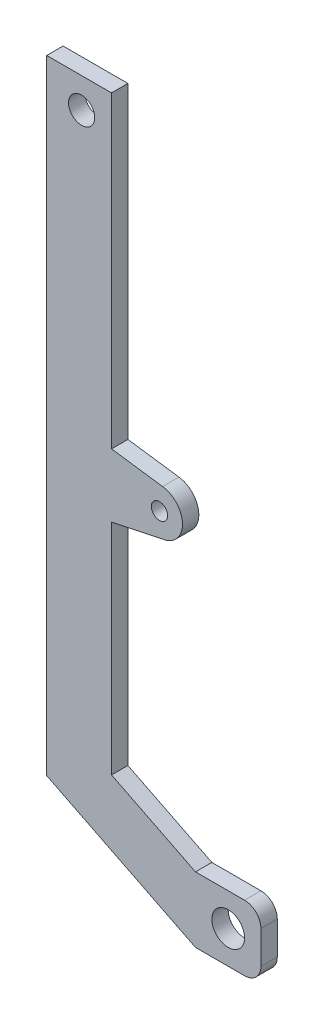
from build123d import *

# Parameters (mm, degrees)
SKETCH1_R           = 5
SKETCH1_R_2         = 2.5
SKETCH1_R_3         = 4
BOSS_EXTRUDE1_DEPTH = 5
FILLET3_R           = 5


with BuildPart() as part:
    # Sketch1 → Boss-Extrude1 (new body)
    with BuildSketch(Plane.XY):
        with BuildLine():
            Line((-10, 10), (10, 10))
            Line((10, 10), (10, -10))
            Line((10, -10), (-10, -10))
            Line((-10, -10), (-55.461021504, 12.730510752))
            Line((-55.461021504, 12.730510752), (-55.461021504, 203.339772328))
            Line((-55.461021504, 203.339772328), (-35.652890409, 203.339772328))
            Line((-35.652890409, 203.339772328), (-35.652890409, 109.119646477))
            Line((-35.652890409, 109.119646477), (-20.037879497, 106.961586302))
            ThreePointArc((-20.037879497, 106.961586302), (-13.976505729, 100.244720099), (-19.555674946, 93.122261648))
            Line((-19.555674946, 93.122261648), (-35.652890409, 89.741846401))
            Line((-35.652890409, 89.741846401), (-35.652890409, 22.826445204))
            Line((-35.652890409, 22.826445204), (-10, 10))
        make_face()
        Circle(SKETCH1_R, mode=Mode.SUBTRACT)
        with Locations((-21, 100)):
            Circle(SKETCH1_R_2, mode=Mode.SUBTRACT)
        with Locations((-44.790115058, 194.172495481)):
            Circle(SKETCH1_R_3, mode=Mode.SUBTRACT)
    extrude(amount=BOSS_EXTRUDE1_DEPTH)

    # Fillet3
    fillet3_edges = [part.edges().sort_by_distance(p)[0] for p in [
        (10, -10, 2.5),
        (10, 10, 2.5),
    ]]
    fillet(fillet3_edges, radius=FILLET3_R)


solid = part.part
